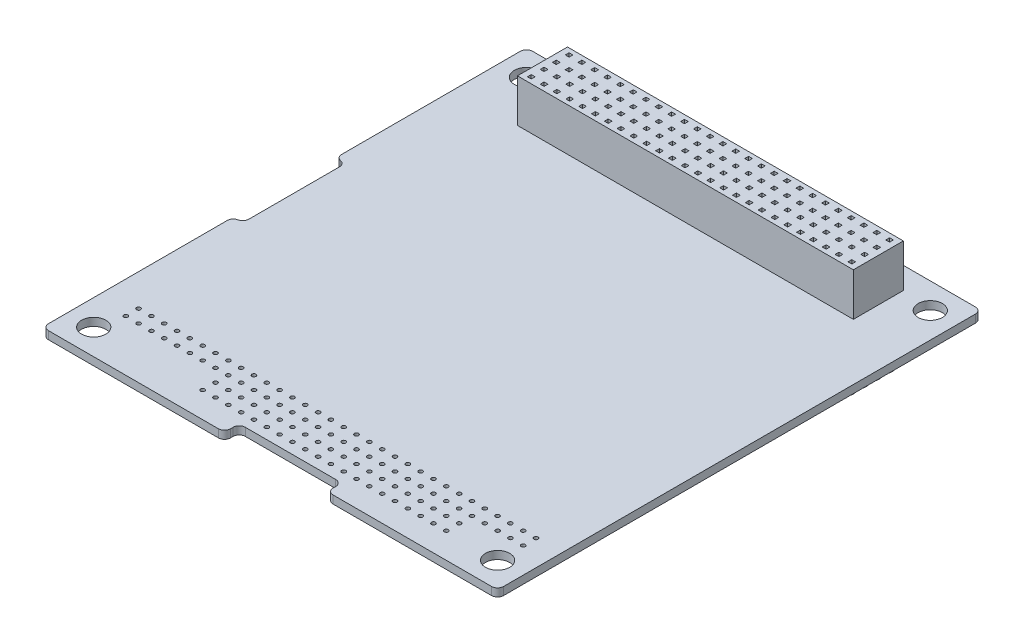
from build123d import *

# Parameters (mm, degrees)
SKETCH1_W           = 90.17
SKETCH1_H           = 95.89
BOSS_EXTRUDE1_DEPTH = 1.57
SKETCH2_W           = 20.32
SKETCH2_H           = 2.93
SKETCH2_W_2         = 1.92
SKETCH2_H_2         = 20.27
SKETCH2_H_3         = 2.92
CUT_EXTRUDE1_DEPTH  = 1.57
SKETCH3_R           = 2.4
CUT_EXTRUDE2_DEPTH  = 1.57
BOSS_EXTRUDE3_DEPTH = 8.509
FILLET7_R           = 1.2
FILLET8_R           = 1.2
FILLET9_R           = 1.2
FILLET10_R          = 1.2
FILLET11_R          = 1.2
FILLET12_R          = 1.2
FILLET13_R          = 1.2
FILLET14_R          = 1.2
FILLET17_R          = 1.2
FILLET18_R          = 1.2
FILLET19_R          = 1.2
FILLET20_R          = 1.2
FILLET21_R          = 1.2
SKETCH7_W           = 0.762
SKETCH7_H           = 0.762
CUT_EXTRUDE4_DEPTH  = 8.509
SKETCH8_W           = 0.762
SKETCH8_H           = 0.762
CUT_EXTRUDE5_DEPTH  = 8.509
SKETCH9_W           = 0.762
SKETCH9_H           = 0.762
CUT_EXTRUDE6_DEPTH  = 8.509
SKETCH10_W          = 0.762
SKETCH10_H          = 0.762
CUT_EXTRUDE7_DEPTH  = 8.509
SKETCH11_R          = 0.4
CUT_EXTRUDE8_DEPTH  = 10
SKETCH12_R          = 0.4
CUT_EXTRUDE9_DEPTH  = 10
SKETCH13_R          = 0.4
CUT_EXTRUDE10_DEPTH = 10
SKETCH14_R          = 0.4
CUT_EXTRUDE11_DEPTH = 10
SKETCH15_W          = 0.635
SKETCH15_H          = 0.635
BOSS_EXTRUDE4_DEPTH = 12.446
SKETCH16_W          = 0.635
SKETCH16_H          = 0.635
BOSS_EXTRUDE5_DEPTH = 12.446


with BuildPart() as part:
    # Sketch1 → Boss-Extrude1 (new body)
    with BuildSketch(Plane(origin=(0, 0, 0), x_dir=(1, 0, 0), z_dir=(0, 1, 0))):
        Rectangle(SKETCH1_W, SKETCH1_H)
    extrude(amount=BOSS_EXTRUDE1_DEPTH)

    # Sketch2 → Cut-Extrude1 (cut)
    with BuildSketch(Plane(origin=(0, 1.57, 0), x_dir=(1, 0, 0), z_dir=(0, 1, 0))):
        with Locations((1.145, 46.48)):
            Rectangle(SKETCH2_W, SKETCH2_H)
        with Locations((-44.125, 0)):
            Rectangle(SKETCH2_W_2, SKETCH2_H_2)
        with Locations((1.145, -46.485)):
            Rectangle(SKETCH2_W, SKETCH2_H_3)
    extrude(amount=-CUT_EXTRUDE1_DEPTH, mode=Mode.SUBTRACT)

    # Sketch3 → Cut-Extrude2 (cut)
    with BuildSketch(Plane(origin=(0, 1.57, 0), x_dir=(1, 0, 0), z_dir=(0, 1, 0))):
        with Locations((-40.005, -42.865)):
            Circle(SKETCH3_R)
        with Locations((40.005, -42.865)):
            Circle(SKETCH3_R)
        with Locations((-40.005, 42.865)):
            Circle(SKETCH3_R)
        with Locations((40.005, 42.865)):
            Circle(SKETCH3_R)
    extrude(amount=-CUT_EXTRUDE2_DEPTH, mode=Mode.SUBTRACT)

    # Sketch4 → Boss-Extrude3 (add)
    with BuildSketch(Plane(origin=(0, 1.57, 0), x_dir=(1, 0, 0), z_dir=(0, 1, 0))):
        Polygon((-32.639, 35.245), (-32.639, 33.721), (33.909, 33.721), (33.909, 43.627), (-32.639, 43.627), align=None)
    extrude(amount=BOSS_EXTRUDE3_DEPTH)

    # Fillet7
    fillet7_edges = [part.edges().sort_by_distance(p)[0] for p in [
        (-9.015, 0.785, 45.025),
    ]]
    fillet(fillet7_edges, radius=FILLET7_R)

    # Fillet8
    fillet8_edges = [part.edges().sort_by_distance(p)[0] for p in [
        (-9.015, 0.785, 47.945),
    ]]
    fillet(fillet8_edges, radius=FILLET8_R)

    # Fillet9
    fillet9_edges = [part.edges().sort_by_distance(p)[0] for p in [
        (11.305, 0.785, 47.945),
        (11.305, 0.785, 45.025),
    ]]
    fillet(fillet9_edges, radius=FILLET9_R)

    # Fillet10
    fillet10_edges = [part.edges().sort_by_distance(p)[0] for p in [
        (45.085, 0.785, 47.945),
    ]]
    fillet(fillet10_edges, radius=FILLET10_R)

    # Fillet11
    fillet11_edges = [part.edges().sort_by_distance(p)[0] for p in [
        (45.085, 0.785, -47.945),
    ]]
    fillet(fillet11_edges, radius=FILLET11_R)

    # Fillet12
    fillet12_edges = [part.edges().sort_by_distance(p)[0] for p in [
        (11.305, 0.785, -45.015),
        (11.305, 0.785, -47.945),
    ]]
    fillet(fillet12_edges, radius=FILLET12_R)

    # Fillet13
    fillet13_edges = [part.edges().sort_by_distance(p)[0] for p in [
        (-9.015, 0.785, -47.945),
        (-9.015, 0.785, -45.015),
    ]]
    fillet(fillet13_edges, radius=FILLET13_R)

    # Fillet14
    fillet14_edges = [part.edges().sort_by_distance(p)[0] for p in [
        (-45.085, 0.785, -47.945),
    ]]
    fillet(fillet14_edges, radius=FILLET14_R)

    # Fillet17
    fillet17_edges = [part.edges().sort_by_distance(p)[0] for p in [
        (-45.085, 0.785, -10.135),
    ]]
    fillet(fillet17_edges, radius=FILLET17_R)

    # Fillet18
    fillet18_edges = [part.edges().sort_by_distance(p)[0] for p in [
        (-43.165, 0.785, -10.135),
    ]]
    fillet(fillet18_edges, radius=FILLET18_R)

    # Fillet19
    fillet19_edges = [part.edges().sort_by_distance(p)[0] for p in [
        (-45.085, 0.785, 10.135),
    ]]
    fillet(fillet19_edges, radius=FILLET19_R)

    # Fillet20
    fillet20_edges = [part.edges().sort_by_distance(p)[0] for p in [
        (-43.165, 0.785, 10.135),
    ]]
    fillet(fillet20_edges, radius=FILLET20_R)

    # Fillet21
    fillet21_edges = [part.edges().sort_by_distance(p)[0] for p in [
        (-45.085, 0.785, 47.945),
    ]]
    fillet(fillet21_edges, radius=FILLET21_R)

    # Sketch7 → Cut-Extrude4 (cut)
    with BuildSketch(Plane(origin=(0, 10.079, 0), x_dir=(1, 0, 0), z_dir=(0, 1, 0))):
        with Locations((-28.575, 34.9275)):
            Rectangle(SKETCH7_W, SKETCH7_H)
        with Locations((-31.115, 34.9275)):
            Rectangle(SKETCH7_W, SKETCH7_H)
        with Locations((-26.035, 34.9275)):
            Rectangle(SKETCH7_W, SKETCH7_H)
        with Locations((-23.495, 34.9275)):
            Rectangle(SKETCH7_W, SKETCH7_H)
        with Locations((-20.955, 34.9275)):
            Rectangle(SKETCH7_W, SKETCH7_H)
        with Locations((-18.415, 34.9275)):
            Rectangle(SKETCH7_W, SKETCH7_H)
        with Locations((-15.875, 34.9275)):
            Rectangle(SKETCH7_W, SKETCH7_H)
        with Locations((-13.335, 34.9275)):
            Rectangle(SKETCH7_W, SKETCH7_H)
        with Locations((-10.795, 34.9275)):
            Rectangle(SKETCH7_W, SKETCH7_H)
        with Locations((-8.255, 34.9275)):
            Rectangle(SKETCH7_W, SKETCH7_H)
        with Locations((-5.715, 34.9275)):
            Rectangle(SKETCH7_W, SKETCH7_H)
        with Locations((-3.175, 34.9275)):
            Rectangle(SKETCH7_W, SKETCH7_H)
        with Locations((-0.635, 34.9275)):
            Rectangle(SKETCH7_W, SKETCH7_H)
        with Locations((1.905, 34.9275)):
            Rectangle(SKETCH7_W, SKETCH7_H)
        with Locations((4.445, 34.9275)):
            Rectangle(SKETCH7_W, SKETCH7_H)
        with Locations((6.985, 34.9275)):
            Rectangle(SKETCH7_W, SKETCH7_H)
        with Locations((9.525, 34.9275)):
            Rectangle(SKETCH7_W, SKETCH7_H)
        with Locations((12.065, 34.9275)):
            Rectangle(SKETCH7_W, SKETCH7_H)
        with Locations((14.605, 34.9275)):
            Rectangle(SKETCH7_W, SKETCH7_H)
        with Locations((17.145, 34.9275)):
            Rectangle(SKETCH7_W, SKETCH7_H)
        with Locations((19.685, 34.9275)):
            Rectangle(SKETCH7_W, SKETCH7_H)
        with Locations((22.225, 34.9275)):
            Rectangle(SKETCH7_W, SKETCH7_H)
        with Locations((24.765, 34.9275)):
            Rectangle(SKETCH7_W, SKETCH7_H)
        with Locations((27.305, 34.9275)):
            Rectangle(SKETCH7_W, SKETCH7_H)
        with Locations((29.845, 34.9275)):
            Rectangle(SKETCH7_W, SKETCH7_H)
        with Locations((32.385, 34.9275)):
            Rectangle(SKETCH7_W, SKETCH7_H)
    extrude(amount=-CUT_EXTRUDE4_DEPTH, mode=Mode.SUBTRACT)

    # Sketch8 → Cut-Extrude5 (cut)
    with BuildSketch(Plane(origin=(0, 10.079, 0), x_dir=(1, 0, 0), z_dir=(0, 1, 0))):
        with Locations((-28.575, 37.4675)):
            Rectangle(SKETCH8_W, SKETCH8_H)
        with Locations((-31.115, 37.4675)):
            Rectangle(SKETCH8_W, SKETCH8_H)
        with Locations((-26.035, 37.4675)):
            Rectangle(SKETCH8_W, SKETCH8_H)
        with Locations((-23.495, 37.4675)):
            Rectangle(SKETCH8_W, SKETCH8_H)
        with Locations((-20.955, 37.4675)):
            Rectangle(SKETCH8_W, SKETCH8_H)
        with Locations((-18.415, 37.4675)):
            Rectangle(SKETCH8_W, SKETCH8_H)
        with Locations((-15.875, 37.4675)):
            Rectangle(SKETCH8_W, SKETCH8_H)
        with Locations((-13.335, 37.4675)):
            Rectangle(SKETCH8_W, SKETCH8_H)
        with Locations((-10.795, 37.4675)):
            Rectangle(SKETCH8_W, SKETCH8_H)
        with Locations((-8.255, 37.4675)):
            Rectangle(SKETCH8_W, SKETCH8_H)
        with Locations((-5.715, 37.4675)):
            Rectangle(SKETCH8_W, SKETCH8_H)
        with Locations((-3.175, 37.4675)):
            Rectangle(SKETCH8_W, SKETCH8_H)
        with Locations((-0.635, 37.4675)):
            Rectangle(SKETCH8_W, SKETCH8_H)
        with Locations((1.905, 37.4675)):
            Rectangle(SKETCH8_W, SKETCH8_H)
        with Locations((4.445, 37.4675)):
            Rectangle(SKETCH8_W, SKETCH8_H)
        with Locations((6.985, 37.4675)):
            Rectangle(SKETCH8_W, SKETCH8_H)
        with Locations((9.525, 37.4675)):
            Rectangle(SKETCH8_W, SKETCH8_H)
        with Locations((12.065, 37.4675)):
            Rectangle(SKETCH8_W, SKETCH8_H)
        with Locations((14.605, 37.4675)):
            Rectangle(SKETCH8_W, SKETCH8_H)
        with Locations((17.145, 37.4675)):
            Rectangle(SKETCH8_W, SKETCH8_H)
        with Locations((19.685, 37.4675)):
            Rectangle(SKETCH8_W, SKETCH8_H)
        with Locations((22.225, 37.4675)):
            Rectangle(SKETCH8_W, SKETCH8_H)
        with Locations((24.765, 37.4675)):
            Rectangle(SKETCH8_W, SKETCH8_H)
        with Locations((27.305, 37.4675)):
            Rectangle(SKETCH8_W, SKETCH8_H)
        with Locations((29.845, 37.4675)):
            Rectangle(SKETCH8_W, SKETCH8_H)
        with Locations((32.385, 37.4675)):
            Rectangle(SKETCH8_W, SKETCH8_H)
    extrude(amount=-CUT_EXTRUDE5_DEPTH, mode=Mode.SUBTRACT)

    # Sketch9 → Cut-Extrude6 (cut)
    with BuildSketch(Plane(origin=(0, 10.079, 0), x_dir=(1, 0, 0), z_dir=(0, 1, 0))):
        with Locations((-28.575, 39.8805)):
            Rectangle(SKETCH9_W, SKETCH9_H)
        with Locations((-31.115, 39.8805)):
            Rectangle(SKETCH9_W, SKETCH9_H)
        with Locations((-26.035, 39.8805)):
            Rectangle(SKETCH9_W, SKETCH9_H)
        with Locations((-23.495, 39.8805)):
            Rectangle(SKETCH9_W, SKETCH9_H)
        with Locations((-20.955, 39.8805)):
            Rectangle(SKETCH9_W, SKETCH9_H)
        with Locations((-18.415, 39.8805)):
            Rectangle(SKETCH9_W, SKETCH9_H)
        with Locations((-15.875, 39.8805)):
            Rectangle(SKETCH9_W, SKETCH9_H)
        with Locations((-13.335, 39.8805)):
            Rectangle(SKETCH9_W, SKETCH9_H)
        with Locations((-10.795, 39.8805)):
            Rectangle(SKETCH9_W, SKETCH9_H)
        with Locations((-8.255, 39.8805)):
            Rectangle(SKETCH9_W, SKETCH9_H)
        with Locations((-5.715, 39.8805)):
            Rectangle(SKETCH9_W, SKETCH9_H)
        with Locations((-3.175, 39.8805)):
            Rectangle(SKETCH9_W, SKETCH9_H)
        with Locations((-0.635, 39.8805)):
            Rectangle(SKETCH9_W, SKETCH9_H)
        with Locations((1.905, 39.8805)):
            Rectangle(SKETCH9_W, SKETCH9_H)
        with Locations((4.445, 39.8805)):
            Rectangle(SKETCH9_W, SKETCH9_H)
        with Locations((6.985, 39.8805)):
            Rectangle(SKETCH9_W, SKETCH9_H)
        with Locations((9.525, 39.8805)):
            Rectangle(SKETCH9_W, SKETCH9_H)
        with Locations((12.065, 39.8805)):
            Rectangle(SKETCH9_W, SKETCH9_H)
        with Locations((14.605, 39.8805)):
            Rectangle(SKETCH9_W, SKETCH9_H)
        with Locations((17.145, 39.8805)):
            Rectangle(SKETCH9_W, SKETCH9_H)
        with Locations((19.685, 39.8805)):
            Rectangle(SKETCH9_W, SKETCH9_H)
        with Locations((22.225, 39.8805)):
            Rectangle(SKETCH9_W, SKETCH9_H)
        with Locations((24.765, 39.8805)):
            Rectangle(SKETCH9_W, SKETCH9_H)
        with Locations((27.305, 39.8805)):
            Rectangle(SKETCH9_W, SKETCH9_H)
        with Locations((29.845, 39.8805)):
            Rectangle(SKETCH9_W, SKETCH9_H)
        with Locations((32.385, 39.8805)):
            Rectangle(SKETCH9_W, SKETCH9_H)
    extrude(amount=-CUT_EXTRUDE6_DEPTH, mode=Mode.SUBTRACT)

    # Sketch10 → Cut-Extrude7 (cut)
    with BuildSketch(Plane(origin=(0, 10.079, 0), x_dir=(1, 0, 0), z_dir=(0, 1, 0))):
        with Locations((-28.575, 42.4205)):
            Rectangle(SKETCH10_W, SKETCH10_H)
        with Locations((-31.115, 42.4205)):
            Rectangle(SKETCH10_W, SKETCH10_H)
        with Locations((-26.035, 42.4205)):
            Rectangle(SKETCH10_W, SKETCH10_H)
        with Locations((-23.495, 42.4205)):
            Rectangle(SKETCH10_W, SKETCH10_H)
        with Locations((-20.955, 42.4205)):
            Rectangle(SKETCH10_W, SKETCH10_H)
        with Locations((-18.415, 42.4205)):
            Rectangle(SKETCH10_W, SKETCH10_H)
        with Locations((-15.875, 42.4205)):
            Rectangle(SKETCH10_W, SKETCH10_H)
        with Locations((-13.335, 42.4205)):
            Rectangle(SKETCH10_W, SKETCH10_H)
        with Locations((-10.795, 42.4205)):
            Rectangle(SKETCH10_W, SKETCH10_H)
        with Locations((-8.255, 42.4205)):
            Rectangle(SKETCH10_W, SKETCH10_H)
        with Locations((-5.715, 42.4205)):
            Rectangle(SKETCH10_W, SKETCH10_H)
        with Locations((-3.175, 42.4205)):
            Rectangle(SKETCH10_W, SKETCH10_H)
        with Locations((-0.635, 42.4205)):
            Rectangle(SKETCH10_W, SKETCH10_H)
        with Locations((1.905, 42.4205)):
            Rectangle(SKETCH10_W, SKETCH10_H)
        with Locations((4.445, 42.4205)):
            Rectangle(SKETCH10_W, SKETCH10_H)
        with Locations((6.985, 42.4205)):
            Rectangle(SKETCH10_W, SKETCH10_H)
        with Locations((9.525, 42.4205)):
            Rectangle(SKETCH10_W, SKETCH10_H)
        with Locations((12.065, 42.4205)):
            Rectangle(SKETCH10_W, SKETCH10_H)
        with Locations((14.605, 42.4205)):
            Rectangle(SKETCH10_W, SKETCH10_H)
        with Locations((17.145, 42.4205)):
            Rectangle(SKETCH10_W, SKETCH10_H)
        with Locations((19.685, 42.4205)):
            Rectangle(SKETCH10_W, SKETCH10_H)
        with Locations((22.225, 42.4205)):
            Rectangle(SKETCH10_W, SKETCH10_H)
        with Locations((24.765, 42.4205)):
            Rectangle(SKETCH10_W, SKETCH10_H)
        with Locations((27.305, 42.4205)):
            Rectangle(SKETCH10_W, SKETCH10_H)
        with Locations((29.845, 42.4205)):
            Rectangle(SKETCH10_W, SKETCH10_H)
        with Locations((32.385, 42.4205)):
            Rectangle(SKETCH10_W, SKETCH10_H)
    extrude(amount=-CUT_EXTRUDE7_DEPTH, mode=Mode.SUBTRACT)

    # Sketch11 → Cut-Extrude8 (cut)
    with BuildSketch(Plane(origin=(0, 1.57, 0), x_dir=(1, 0, 0), z_dir=(0, 1, 0))):
        with Locations((-38.735, -37.785)):
            Circle(SKETCH11_R)
        with Locations((-36.195, -37.785)):
            Circle(SKETCH11_R)
        with Locations((-33.655, -37.785)):
            Circle(SKETCH11_R)
        with Locations((-31.115, -37.785)):
            Circle(SKETCH11_R)
        with Locations((-28.575, -37.785)):
            Circle(SKETCH11_R)
        with Locations((-26.035, -37.785)):
            Circle(SKETCH11_R)
        with Locations((-23.495, -37.785)):
            Circle(SKETCH11_R)
        with Locations((-20.955, -37.785)):
            Circle(SKETCH11_R)
        with Locations((-18.415, -37.785)):
            Circle(SKETCH11_R)
        with Locations((-15.875, -37.785)):
            Circle(SKETCH11_R)
        with Locations((-13.335, -37.785)):
            Circle(SKETCH11_R)
        with Locations((-10.795, -37.785)):
            Circle(SKETCH11_R)
        with Locations((-8.255, -37.785)):
            Circle(SKETCH11_R)
        with Locations((-5.715, -37.785)):
            Circle(SKETCH11_R)
        with Locations((-3.175, -37.785)):
            Circle(SKETCH11_R)
        with Locations((-0.635, -37.785)):
            Circle(SKETCH11_R)
        with Locations((1.905, -37.785)):
            Circle(SKETCH11_R)
        with Locations((4.445, -37.785)):
            Circle(SKETCH11_R)
        with Locations((6.985, -37.785)):
            Circle(SKETCH11_R)
        with Locations((9.525, -37.785)):
            Circle(SKETCH11_R)
        with Locations((12.065, -37.785)):
            Circle(SKETCH11_R)
        with Locations((14.605, -37.785)):
            Circle(SKETCH11_R)
        with Locations((17.145, -37.785)):
            Circle(SKETCH11_R)
        with Locations((19.685, -37.785)):
            Circle(SKETCH11_R)
        with Locations((22.225, -37.785)):
            Circle(SKETCH11_R)
        with Locations((24.765, -37.785)):
            Circle(SKETCH11_R)
        with Locations((27.305, -37.785)):
            Circle(SKETCH11_R)
        with Locations((29.845, -37.785)):
            Circle(SKETCH11_R)
        with Locations((32.385, -37.785)):
            Circle(SKETCH11_R)
        with Locations((34.925, -37.785)):
            Circle(SKETCH11_R)
        with Locations((37.465, -37.785)):
            Circle(SKETCH11_R)
        with Locations((40.005, -37.785)):
            Circle(SKETCH11_R)
    extrude(amount=-CUT_EXTRUDE8_DEPTH, mode=Mode.SUBTRACT)

    # Sketch12 → Cut-Extrude9 (cut)
    with BuildSketch(Plane(origin=(0, 1.57, 0), x_dir=(1, 0, 0), z_dir=(0, 1, 0))):
        with Locations((-38.735, -35.245)):
            Circle(SKETCH12_R)
        with Locations((-36.195, -35.245)):
            Circle(SKETCH12_R)
        with Locations((-33.655, -35.245)):
            Circle(SKETCH12_R)
        with Locations((-31.115, -35.245)):
            Circle(SKETCH12_R)
        with Locations((-28.575, -35.245)):
            Circle(SKETCH12_R)
        with Locations((-26.035, -35.245)):
            Circle(SKETCH12_R)
        with Locations((-23.495, -35.245)):
            Circle(SKETCH12_R)
        with Locations((-20.955, -35.245)):
            Circle(SKETCH12_R)
        with Locations((-18.415, -35.245)):
            Circle(SKETCH12_R)
        with Locations((-15.875, -35.245)):
            Circle(SKETCH12_R)
        with Locations((-13.335, -35.245)):
            Circle(SKETCH12_R)
        with Locations((-10.795, -35.245)):
            Circle(SKETCH12_R)
        with Locations((-8.255, -35.245)):
            Circle(SKETCH12_R)
        with Locations((-5.715, -35.245)):
            Circle(SKETCH12_R)
        with Locations((-3.175, -35.245)):
            Circle(SKETCH12_R)
        with Locations((-0.635, -35.245)):
            Circle(SKETCH12_R)
        with Locations((1.905, -35.245)):
            Circle(SKETCH12_R)
        with Locations((4.445, -35.245)):
            Circle(SKETCH12_R)
        with Locations((6.985, -35.245)):
            Circle(SKETCH12_R)
        with Locations((9.525, -35.245)):
            Circle(SKETCH12_R)
        with Locations((12.065, -35.245)):
            Circle(SKETCH12_R)
        with Locations((14.605, -35.245)):
            Circle(SKETCH12_R)
        with Locations((17.145, -35.245)):
            Circle(SKETCH12_R)
        with Locations((19.685, -35.245)):
            Circle(SKETCH12_R)
        with Locations((22.225, -35.245)):
            Circle(SKETCH12_R)
        with Locations((24.765, -35.245)):
            Circle(SKETCH12_R)
        with Locations((27.305, -35.245)):
            Circle(SKETCH12_R)
        with Locations((29.845, -35.245)):
            Circle(SKETCH12_R)
        with Locations((32.385, -35.245)):
            Circle(SKETCH12_R)
        with Locations((34.925, -35.245)):
            Circle(SKETCH12_R)
        with Locations((37.465, -35.245)):
            Circle(SKETCH12_R)
        with Locations((40.005, -35.245)):
            Circle(SKETCH12_R)
    extrude(amount=-CUT_EXTRUDE9_DEPTH, mode=Mode.SUBTRACT)

    # Sketch13 → Cut-Extrude10 (cut)
    with BuildSketch(Plane(origin=(0, 1.57, 0), x_dir=(1, 0, 0), z_dir=(0, 1, 0))):
        with Locations((-18.415, -42.865)):
            Circle(SKETCH13_R)
        with Locations((-15.875, -42.865)):
            Circle(SKETCH13_R)
        with Locations((-13.335, -42.865)):
            Circle(SKETCH13_R)
        with Locations((-10.795, -42.865)):
            Circle(SKETCH13_R)
        with Locations((-8.255, -42.865)):
            Circle(SKETCH13_R)
        with Locations((-5.715, -42.865)):
            Circle(SKETCH13_R)
        with Locations((-3.175, -42.865)):
            Circle(SKETCH13_R)
        with Locations((-0.635, -42.865)):
            Circle(SKETCH13_R)
        with Locations((1.905, -42.865)):
            Circle(SKETCH13_R)
        with Locations((4.445, -42.865)):
            Circle(SKETCH13_R)
        with Locations((6.985, -42.865)):
            Circle(SKETCH13_R)
        with Locations((9.525, -42.865)):
            Circle(SKETCH13_R)
        with Locations((12.065, -42.865)):
            Circle(SKETCH13_R)
        with Locations((14.605, -42.865)):
            Circle(SKETCH13_R)
        with Locations((17.145, -42.865)):
            Circle(SKETCH13_R)
        with Locations((19.685, -42.865)):
            Circle(SKETCH13_R)
        with Locations((22.225, -42.865)):
            Circle(SKETCH13_R)
        with Locations((24.765, -42.865)):
            Circle(SKETCH13_R)
        with Locations((27.305, -42.865)):
            Circle(SKETCH13_R)
        with Locations((29.845, -42.865)):
            Circle(SKETCH13_R)
    extrude(amount=-CUT_EXTRUDE10_DEPTH, mode=Mode.SUBTRACT)

    # Sketch14 → Cut-Extrude11 (cut)
    with BuildSketch(Plane(origin=(0, 1.57, 0), x_dir=(1, 0, 0), z_dir=(0, 1, 0))):
        with Locations((-18.415, -40.325)):
            Circle(SKETCH14_R)
        with Locations((-15.875, -40.325)):
            Circle(SKETCH14_R)
        with Locations((-13.335, -40.325)):
            Circle(SKETCH14_R)
        with Locations((-10.795, -40.325)):
            Circle(SKETCH14_R)
        with Locations((-8.255, -40.325)):
            Circle(SKETCH14_R)
        with Locations((-5.715, -40.325)):
            Circle(SKETCH14_R)
        with Locations((-3.175, -40.325)):
            Circle(SKETCH14_R)
        with Locations((-0.635, -40.325)):
            Circle(SKETCH14_R)
        with Locations((1.905, -40.325)):
            Circle(SKETCH14_R)
        with Locations((4.445, -40.325)):
            Circle(SKETCH14_R)
        with Locations((6.985, -40.325)):
            Circle(SKETCH14_R)
        with Locations((9.525, -40.325)):
            Circle(SKETCH14_R)
        with Locations((12.065, -40.325)):
            Circle(SKETCH14_R)
        with Locations((14.605, -40.325)):
            Circle(SKETCH14_R)
        with Locations((17.145, -40.325)):
            Circle(SKETCH14_R)
        with Locations((19.685, -40.325)):
            Circle(SKETCH14_R)
        with Locations((22.225, -40.325)):
            Circle(SKETCH14_R)
        with Locations((24.765, -40.325)):
            Circle(SKETCH14_R)
        with Locations((27.305, -40.325)):
            Circle(SKETCH14_R)
        with Locations((29.845, -40.325)):
            Circle(SKETCH14_R)
    extrude(amount=-CUT_EXTRUDE11_DEPTH, mode=Mode.SUBTRACT)

    # Sketch15 → Boss-Extrude4 (add)
    with BuildSketch(Plane.XZ):
        with Locations((-28.575, -42.4205)):
            Rectangle(SKETCH15_W, SKETCH15_H)
        with Locations((-31.115, -42.4205)):
            Rectangle(SKETCH15_W, SKETCH15_H)
        with Locations((-26.035, -42.4205)):
            Rectangle(SKETCH15_W, SKETCH15_H)
        with Locations((-23.495, -42.4205)):
            Rectangle(SKETCH15_W, SKETCH15_H)
        with Locations((-20.955, -42.4205)):
            Rectangle(SKETCH15_W, SKETCH15_H)
        with Locations((-18.415, -42.4205)):
            Rectangle(SKETCH15_W, SKETCH15_H)
        with Locations((-15.875, -42.4205)):
            Rectangle(SKETCH15_W, SKETCH15_H)
        with Locations((-13.335, -42.4205)):
            Rectangle(SKETCH15_W, SKETCH15_H)
        with Locations((-10.795, -42.4205)):
            Rectangle(SKETCH15_W, SKETCH15_H)
        with Locations((-8.255, -42.4205)):
            Rectangle(SKETCH15_W, SKETCH15_H)
        with Locations((-5.715, -42.4205)):
            Rectangle(SKETCH15_W, SKETCH15_H)
        with Locations((-3.175, -42.4205)):
            Rectangle(SKETCH15_W, SKETCH15_H)
        with Locations((-0.635, -42.4205)):
            Rectangle(SKETCH15_W, SKETCH15_H)
        with Locations((1.905, -42.4205)):
            Rectangle(SKETCH15_W, SKETCH15_H)
        with Locations((4.445, -42.4205)):
            Rectangle(SKETCH15_W, SKETCH15_H)
        with Locations((6.985, -42.4205)):
            Rectangle(SKETCH15_W, SKETCH15_H)
        with Locations((9.525, -42.4205)):
            Rectangle(SKETCH15_W, SKETCH15_H)
        with Locations((12.065, -42.4205)):
            Rectangle(SKETCH15_W, SKETCH15_H)
        with Locations((14.605, -42.4205)):
            Rectangle(SKETCH15_W, SKETCH15_H)
        with Locations((17.145, -42.4205)):
            Rectangle(SKETCH15_W, SKETCH15_H)
        with Locations((19.685, -42.4205)):
            Rectangle(SKETCH15_W, SKETCH15_H)
        with Locations((22.225, -42.4205)):
            Rectangle(SKETCH15_W, SKETCH15_H)
        with Locations((24.765, -42.4205)):
            Rectangle(SKETCH15_W, SKETCH15_H)
        with Locations((27.305, -42.4205)):
            Rectangle(SKETCH15_W, SKETCH15_H)
        with Locations((29.845, -42.4205)):
            Rectangle(SKETCH15_W, SKETCH15_H)
        with Locations((32.385, -42.4205)):
            Rectangle(SKETCH15_W, SKETCH15_H)
    extrude(amount=BOSS_EXTRUDE4_DEPTH)

    # Sketch16 → Boss-Extrude5 (add)
    with BuildSketch(Plane.XZ):
        with Locations((-31.115, -39.8805)):
            Rectangle(SKETCH16_W, SKETCH16_H)
        with Locations((-31.115, -37.3405)):
            Rectangle(SKETCH16_W, SKETCH16_H)
        with Locations((-28.575, -39.8805)):
            Rectangle(SKETCH16_W, SKETCH16_H)
        with Locations((-31.115, -34.8005)):
            Rectangle(SKETCH16_W, SKETCH16_H)
        with Locations((-28.575, -37.3405)):
            Rectangle(SKETCH16_W, SKETCH16_H)
        with Locations((-28.575, -34.8005)):
            Rectangle(SKETCH16_W, SKETCH16_H)
        with Locations((-26.035, -39.8805)):
            Rectangle(SKETCH16_W, SKETCH16_H)
        with Locations((-26.035, -37.3405)):
            Rectangle(SKETCH16_W, SKETCH16_H)
        with Locations((-26.035, -34.8005)):
            Rectangle(SKETCH16_W, SKETCH16_H)
        with Locations((-23.495, -39.8805)):
            Rectangle(SKETCH16_W, SKETCH16_H)
        with Locations((-23.495, -37.3405)):
            Rectangle(SKETCH16_W, SKETCH16_H)
        with Locations((-23.495, -34.8005)):
            Rectangle(SKETCH16_W, SKETCH16_H)
        with Locations((-20.955, -39.8805)):
            Rectangle(SKETCH16_W, SKETCH16_H)
        with Locations((-20.955, -37.3405)):
            Rectangle(SKETCH16_W, SKETCH16_H)
        with Locations((-20.955, -34.8005)):
            Rectangle(SKETCH16_W, SKETCH16_H)
        with Locations((-18.415, -39.8805)):
            Rectangle(SKETCH16_W, SKETCH16_H)
        with Locations((-18.415, -37.3405)):
            Rectangle(SKETCH16_W, SKETCH16_H)
        with Locations((-18.415, -34.8005)):
            Rectangle(SKETCH16_W, SKETCH16_H)
        with Locations((-15.875, -39.8805)):
            Rectangle(SKETCH16_W, SKETCH16_H)
        with Locations((-15.875, -37.3405)):
            Rectangle(SKETCH16_W, SKETCH16_H)
        with Locations((-15.875, -34.8005)):
            Rectangle(SKETCH16_W, SKETCH16_H)
        with Locations((-13.335, -39.8805)):
            Rectangle(SKETCH16_W, SKETCH16_H)
        with Locations((-13.335, -37.3405)):
            Rectangle(SKETCH16_W, SKETCH16_H)
        with Locations((-13.335, -34.8005)):
            Rectangle(SKETCH16_W, SKETCH16_H)
        with Locations((-10.795, -39.8805)):
            Rectangle(SKETCH16_W, SKETCH16_H)
        with Locations((-10.795, -37.3405)):
            Rectangle(SKETCH16_W, SKETCH16_H)
        with Locations((-10.795, -34.8005)):
            Rectangle(SKETCH16_W, SKETCH16_H)
        with Locations((-8.255, -39.8805)):
            Rectangle(SKETCH16_W, SKETCH16_H)
        with Locations((-8.255, -37.3405)):
            Rectangle(SKETCH16_W, SKETCH16_H)
        with Locations((-8.255, -34.8005)):
            Rectangle(SKETCH16_W, SKETCH16_H)
        with Locations((-5.715, -39.8805)):
            Rectangle(SKETCH16_W, SKETCH16_H)
        with Locations((-5.715, -37.3405)):
            Rectangle(SKETCH16_W, SKETCH16_H)
        with Locations((-5.715, -34.8005)):
            Rectangle(SKETCH16_W, SKETCH16_H)
        with Locations((-3.175, -39.8805)):
            Rectangle(SKETCH16_W, SKETCH16_H)
        with Locations((-3.175, -37.3405)):
            Rectangle(SKETCH16_W, SKETCH16_H)
        with Locations((-3.175, -34.8005)):
            Rectangle(SKETCH16_W, SKETCH16_H)
        with Locations((-0.635, -39.8805)):
            Rectangle(SKETCH16_W, SKETCH16_H)
        with Locations((-0.635, -37.3405)):
            Rectangle(SKETCH16_W, SKETCH16_H)
        with Locations((-0.635, -34.8005)):
            Rectangle(SKETCH16_W, SKETCH16_H)
        with Locations((1.905, -39.8805)):
            Rectangle(SKETCH16_W, SKETCH16_H)
        with Locations((1.905, -37.3405)):
            Rectangle(SKETCH16_W, SKETCH16_H)
        with Locations((1.905, -34.8005)):
            Rectangle(SKETCH16_W, SKETCH16_H)
        with Locations((4.445, -39.8805)):
            Rectangle(SKETCH16_W, SKETCH16_H)
        with Locations((4.445, -37.3405)):
            Rectangle(SKETCH16_W, SKETCH16_H)
        with Locations((4.445, -34.8005)):
            Rectangle(SKETCH16_W, SKETCH16_H)
        with Locations((6.985, -39.8805)):
            Rectangle(SKETCH16_W, SKETCH16_H)
        with Locations((6.985, -37.3405)):
            Rectangle(SKETCH16_W, SKETCH16_H)
        with Locations((6.985, -34.8005)):
            Rectangle(SKETCH16_W, SKETCH16_H)
        with Locations((9.525, -39.8805)):
            Rectangle(SKETCH16_W, SKETCH16_H)
        with Locations((9.525, -37.3405)):
            Rectangle(SKETCH16_W, SKETCH16_H)
        with Locations((9.525, -34.8005)):
            Rectangle(SKETCH16_W, SKETCH16_H)
        with Locations((12.065, -39.8805)):
            Rectangle(SKETCH16_W, SKETCH16_H)
        with Locations((12.065, -37.3405)):
            Rectangle(SKETCH16_W, SKETCH16_H)
        with Locations((12.065, -34.8005)):
            Rectangle(SKETCH16_W, SKETCH16_H)
        with Locations((14.605, -39.8805)):
            Rectangle(SKETCH16_W, SKETCH16_H)
        with Locations((14.605, -37.3405)):
            Rectangle(SKETCH16_W, SKETCH16_H)
        with Locations((14.605, -34.8005)):
            Rectangle(SKETCH16_W, SKETCH16_H)
        with Locations((17.145, -39.8805)):
            Rectangle(SKETCH16_W, SKETCH16_H)
        with Locations((17.145, -37.3405)):
            Rectangle(SKETCH16_W, SKETCH16_H)
        with Locations((17.145, -34.8005)):
            Rectangle(SKETCH16_W, SKETCH16_H)
        with Locations((19.685, -39.8805)):
            Rectangle(SKETCH16_W, SKETCH16_H)
        with Locations((19.685, -37.3405)):
            Rectangle(SKETCH16_W, SKETCH16_H)
        with Locations((19.685, -34.8005)):
            Rectangle(SKETCH16_W, SKETCH16_H)
        with Locations((22.225, -39.8805)):
            Rectangle(SKETCH16_W, SKETCH16_H)
        with Locations((22.225, -37.3405)):
            Rectangle(SKETCH16_W, SKETCH16_H)
        with Locations((22.225, -34.8005)):
            Rectangle(SKETCH16_W, SKETCH16_H)
        with Locations((24.765, -39.8805)):
            Rectangle(SKETCH16_W, SKETCH16_H)
        with Locations((24.765, -37.3405)):
            Rectangle(SKETCH16_W, SKETCH16_H)
        with Locations((24.765, -34.8005)):
            Rectangle(SKETCH16_W, SKETCH16_H)
        with Locations((27.305, -39.8805)):
            Rectangle(SKETCH16_W, SKETCH16_H)
        with Locations((27.305, -37.3405)):
            Rectangle(SKETCH16_W, SKETCH16_H)
        with Locations((27.305, -34.8005)):
            Rectangle(SKETCH16_W, SKETCH16_H)
        with Locations((29.845, -39.8805)):
            Rectangle(SKETCH16_W, SKETCH16_H)
        with Locations((29.845, -37.3405)):
            Rectangle(SKETCH16_W, SKETCH16_H)
        with Locations((29.845, -34.8005)):
            Rectangle(SKETCH16_W, SKETCH16_H)
        with Locations((32.385, -39.8805)):
            Rectangle(SKETCH16_W, SKETCH16_H)
        with Locations((32.385, -37.3405)):
            Rectangle(SKETCH16_W, SKETCH16_H)
        with Locations((32.385, -34.8005)):
            Rectangle(SKETCH16_W, SKETCH16_H)
    extrude(amount=BOSS_EXTRUDE5_DEPTH)


solid = part.part
